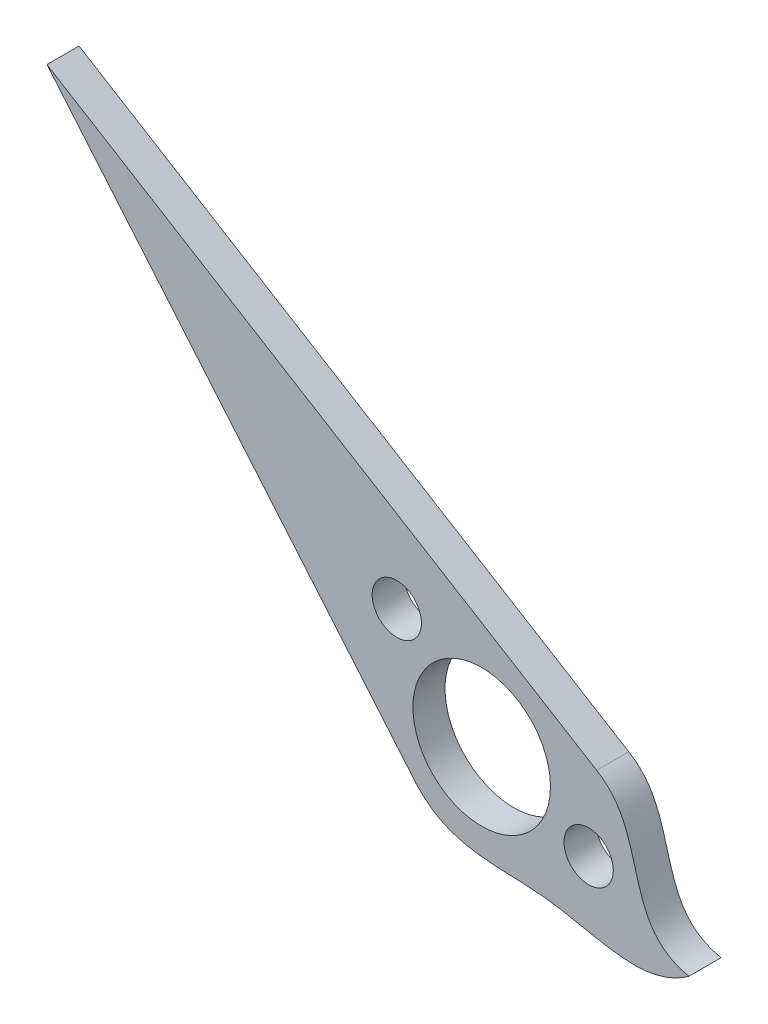
from build123d import *

# Parameters (mm, degrees)
SKETCH1_R           = 2.15
SKETCH1_R_2         = 6
BOSS_EXTRUDE3_DEPTH = 2.8


with BuildPart() as part:
    # Sketch1 → Boss-Extrude3 (new body)
    with BuildSketch(Plane.XY):
        with BuildLine():
            Line((-37.924214893, 32.584565744), (-5.686522489, -5.666580209))
            add(Edge.make_bspline(
                [(-5.686522489, -5.666580209), (-2.651423239, -9.056899373), (6.130443561, -7.247267918), (14.121529515, -11.186326161), (18.079309688, -8.286937629)],
                knots=[0, 0, 0, 0, 0.48864069, 1, 1, 1, 1], degree=3))
            add(Edge.make_bspline(
                [(10.02691297, 3.243406885), (14.694215428, 0.510246033), (12.106900773, -7.071260538), (18.079309688, -8.286937629)],
                knots=[0, 0, 0, 0, 1, 1, 1, 1], degree=3))
            Line((10.02691297, 3.243406885), (-37.924214893, 32.584565744))
        make_face()
        with Locations((9.329230051, -3.600759177)):
            Circle(SKETCH1_R, mode=Mode.SUBTRACT)
        Circle(SKETCH1_R_2, mode=Mode.SUBTRACT)
        with Locations((-7.406949835, 6.718414556)):
            Circle(SKETCH1_R, mode=Mode.SUBTRACT)
    extrude(amount=BOSS_EXTRUDE3_DEPTH)


solid = part.part
